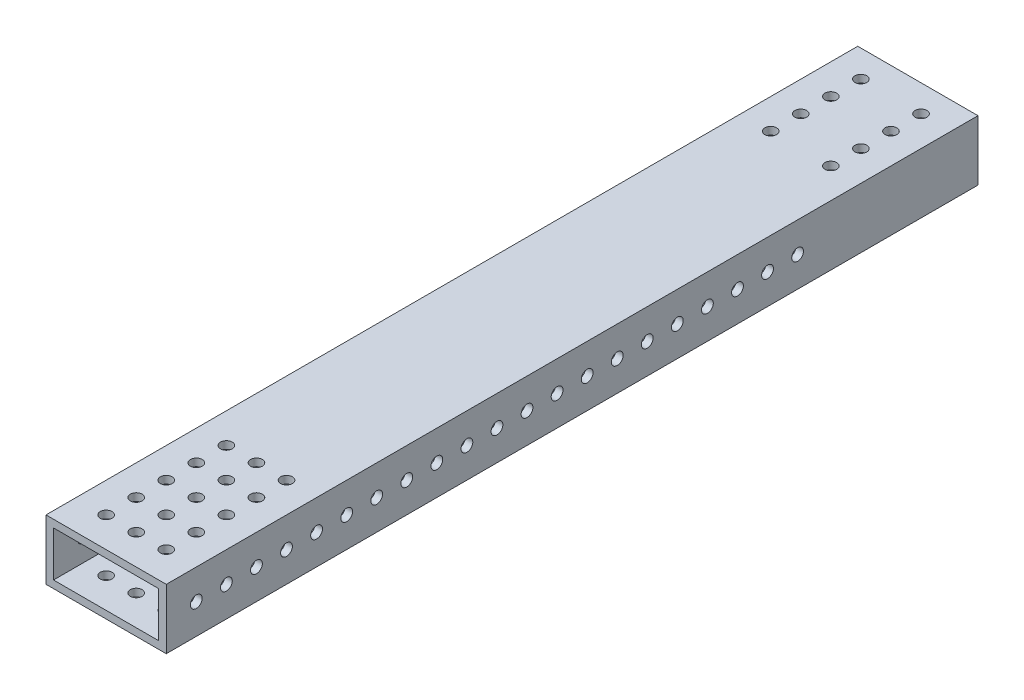
from build123d import *

# Parameters (mm, degrees)
SKETCH1_W           = 50.8
SKETCH1_H           = 342.9
BOSS_EXTRUDE1_DEPTH = 25.4
SHELL1_T            = -3.175
SKETCH2_R           = 2.4892
CUT_EXTRUDE1_DEPTH  = 348.571877458
SKETCH3_R           = 2.4892
CUT_EXTRUDE2_DEPTH  = 348.571877458


with BuildPart() as part:
    # Sketch1 → Boss-Extrude1 (new body)
    with BuildSketch(Plane(origin=(0, 0, 0), x_dir=(1, 0, 0), z_dir=(0, 1, 0))):
        with Locations((25.4, 171.45)):
            Rectangle(SKETCH1_W, SKETCH1_H)
    extrude(amount=BOSS_EXTRUDE1_DEPTH)

    # Shell1
    shell1_openings = [part.faces().sort_by_distance(p)[0] for p in [
        (25.4, 12.7, -342.9),
        (25.4, 12.7, 0),
    ]]
    offset(amount=SHELL1_T, openings=shell1_openings, kind=Kind.INTERSECTION)

    # Sketch2 → Cut-Extrude1 (cut, through all)
    with BuildSketch(Plane.ZY):
        with Locations((-12.7, 12.7)):
            Circle(SKETCH2_R)
        with Locations((-25.4, 12.7)):
            Circle(SKETCH2_R)
        with Locations((-38.1, 12.7)):
            Circle(SKETCH2_R)
        with Locations((-50.8, 12.7)):
            Circle(SKETCH2_R)
        with Locations((-63.5, 12.7)):
            Circle(SKETCH2_R)
        with Locations((-76.2, 12.7)):
            Circle(SKETCH2_R)
        with Locations((-88.9, 12.7)):
            Circle(SKETCH2_R)
        with Locations((-101.6, 12.7)):
            Circle(SKETCH2_R)
        with Locations((-114.3, 12.7)):
            Circle(SKETCH2_R)
        with Locations((-127, 12.7)):
            Circle(SKETCH2_R)
        with Locations((-139.7, 12.7)):
            Circle(SKETCH2_R)
        with Locations((-152.4, 12.7)):
            Circle(SKETCH2_R)
        with Locations((-165.1, 12.7)):
            Circle(SKETCH2_R)
        with Locations((-177.8, 12.7)):
            Circle(SKETCH2_R)
        with Locations((-190.5, 12.7)):
            Circle(SKETCH2_R)
        with Locations((-203.2, 12.7)):
            Circle(SKETCH2_R)
        with Locations((-215.9, 12.7)):
            Circle(SKETCH2_R)
        with Locations((-228.6, 12.7)):
            Circle(SKETCH2_R)
        with Locations((-241.3, 12.7)):
            Circle(SKETCH2_R)
        with Locations((-254, 12.7)):
            Circle(SKETCH2_R)
        with Locations((-266.7, 12.7)):
            Circle(SKETCH2_R)
    extrude(amount=-CUT_EXTRUDE1_DEPTH, mode=Mode.SUBTRACT)

    # Sketch3 → Cut-Extrude2 (cut, through all)
    with BuildSketch(Plane(origin=(0, 25.4, 0), x_dir=(1, 0, 0), z_dir=(0, 1, 0))):
        with Locations((12.7, 293.424634479)):
            Circle(SKETCH3_R)
        with Locations((38.1, 293.424634479)):
            Circle(SKETCH3_R)
        with Locations((38.1, 306.124634479)):
            Circle(SKETCH3_R)
        with Locations((12.7, 306.124634479)):
            Circle(SKETCH3_R)
        with Locations((12.7, 318.824634479)):
            Circle(SKETCH3_R)
        with Locations((38.1, 318.824634479)):
            Circle(SKETCH3_R)
        with Locations((38.1, 331.524634479)):
            Circle(SKETCH3_R)
        with Locations((12.7, 331.524634479)):
            Circle(SKETCH3_R)
        with Locations((38.1, 63.5)):
            Circle(SKETCH3_R)
        with Locations((25.4, 63.5)):
            Circle(SKETCH3_R)
        with Locations((12.7, 63.5)):
            Circle(SKETCH3_R)
        with Locations((12.7, 50.8)):
            Circle(SKETCH3_R)
        with Locations((25.4, 50.8)):
            Circle(SKETCH3_R)
        with Locations((38.1, 50.8)):
            Circle(SKETCH3_R)
        with Locations((12.7, 38.1)):
            Circle(SKETCH3_R)
        with Locations((25.4, 38.1)):
            Circle(SKETCH3_R)
        with Locations((38.1, 38.1)):
            Circle(SKETCH3_R)
        with Locations((38.1, 25.4)):
            Circle(SKETCH3_R)
        with Locations((25.4, 25.4)):
            Circle(SKETCH3_R)
        with Locations((12.7, 25.4)):
            Circle(SKETCH3_R)
        with Locations((12.7, 12.7)):
            Circle(SKETCH3_R)
        with Locations((25.4, 12.7)):
            Circle(SKETCH3_R)
        with Locations((38.1, 12.7)):
            Circle(SKETCH3_R)
    extrude(amount=-CUT_EXTRUDE2_DEPTH, mode=Mode.SUBTRACT)


solid = part.part
